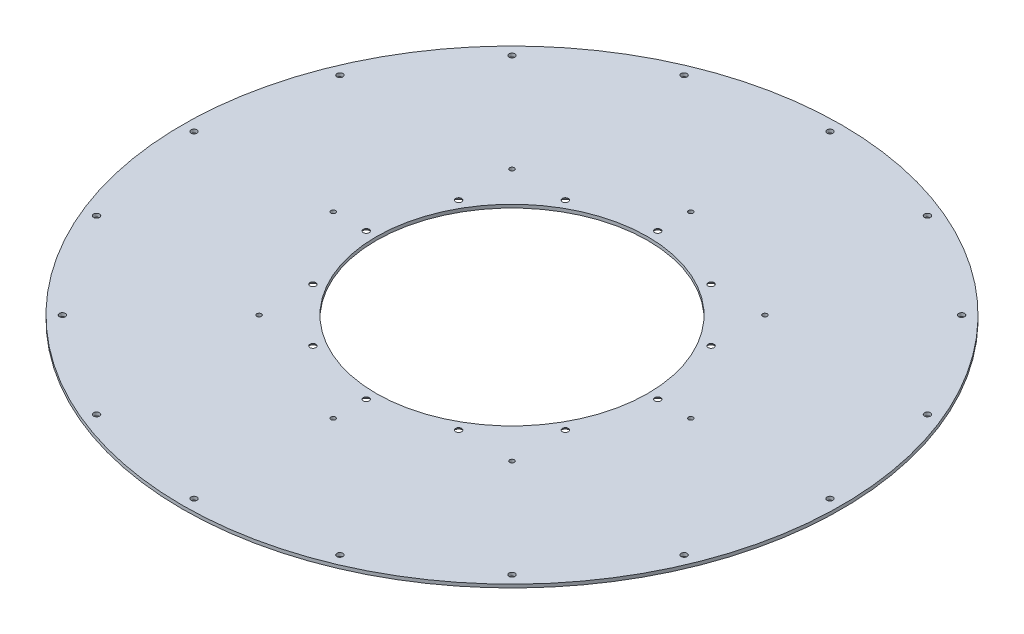
from build123d import *

# Parameters (mm, degrees)
SKETCH1_R                    = 497.5
SKETCH1_R_2                  = 205
BOSS_EXTRUDE1_DEPTH          = 5
SKETCH2_R                    = 4.5
SKETCH2_R_2                  = 3.5
CUT_EXTRUDE1_DEPTH           = 10
CIRPATTERN1_OUTLINE_R        = 4.5
CIRPATTERN1_DEPTH            = 5
CIRPATTERN2_COUNT            = 8
SKETCH3_R                    = 4.5
CUT_EXTRUDE3_DEPTH           = 10
CUT_EXTRUDE3_DRAFT           = 40
CIRPATTERN3_COPY_1_SKETCH_R  = 4.5
CIRPATTERN3_COPY_1_DEPTH     = 10
CIRPATTERN3_COPY_1_DRAFT     = 40
CIRPATTERN3_COPY_2_SKETCH_R  = 4.5
CIRPATTERN3_COPY_2_DEPTH     = 10
CIRPATTERN3_COPY_2_DRAFT     = 40
CIRPATTERN3_COPY_3_SKETCH_R  = 4.5
CIRPATTERN3_COPY_3_DEPTH     = 10
CIRPATTERN3_COPY_3_DRAFT     = 40
CIRPATTERN3_COPY_4_SKETCH_R  = 4.5
CIRPATTERN3_COPY_4_DEPTH     = 10
CIRPATTERN3_COPY_4_DRAFT     = 40
CIRPATTERN3_COPY_5_SKETCH_R  = 4.5
CIRPATTERN3_COPY_5_DEPTH     = 10
CIRPATTERN3_COPY_5_DRAFT     = 40
CIRPATTERN3_COPY_6_SKETCH_R  = 4.5
CIRPATTERN3_COPY_6_DEPTH     = 10
CIRPATTERN3_COPY_6_DRAFT     = 40
CIRPATTERN3_COPY_7_SKETCH_R  = 4.5
CIRPATTERN3_COPY_7_DEPTH     = 10
CIRPATTERN3_COPY_7_DRAFT     = 40
CIRPATTERN3_COPY_8_SKETCH_R  = 4.5
CIRPATTERN3_COPY_8_DEPTH     = 10
CIRPATTERN3_COPY_8_DRAFT     = 40
CIRPATTERN3_COPY_9_SKETCH_R  = 4.5
CIRPATTERN3_COPY_9_DEPTH     = 10
CIRPATTERN3_COPY_9_DRAFT     = 40
CIRPATTERN3_COPY_10_SKETCH_R = 4.5
CIRPATTERN3_COPY_10_DEPTH    = 10
CIRPATTERN3_COPY_10_DRAFT    = 40
CIRPATTERN3_COPY_11_SKETCH_R = 4.5
CIRPATTERN3_COPY_11_DEPTH    = 10
CIRPATTERN3_COPY_11_DRAFT    = 40


# Read off the part's stored shape, not the designer's step: CirPattern1
with BuildPart() as part:
    # Sketch1 → Boss-Extrude1 (new body)
    with BuildSketch(Plane(origin=(0, 0, 0), x_dir=(1, 0, 0), z_dir=(0, 1, 0))):
        with Locations(Location((0, 0, 0), (0, 0, 270))):
            Circle(SKETCH1_R)
        with Locations(Location((0, 0, 0), (0, 0, 270))):
            Circle(SKETCH1_R_2, mode=Mode.SUBTRACT)
    extrude(amount=BOSS_EXTRUDE1_DEPTH)

    # Sketch2 → Cut-Extrude1 (cut)
    with BuildSketch(Plane(origin=(0, 5, 0), x_dir=(1, 0, 0), z_dir=(0, 1, 0))):
        with Locations(Location((0, 480, 0), (0, 0, 270))):
            Circle(SKETCH2_R)
        with Locations(Location((0, 270, 0), (0, 0, 270))):
            Circle(SKETCH2_R_2)
    cut_extrude1 = extrude(amount=-CUT_EXTRUDE1_DEPTH, mode=Mode.SUBTRACT)

    # CirPattern1 outline → CirPattern1 (cut)
    with BuildSketch(Plane(origin=(0, 0, 0), x_dir=(1, 0, 0), z_dir=(0, 1, 0))):
        with Locations((183.688047535, 443.462175605)):
            Circle(CIRPATTERN1_OUTLINE_R)
        with Locations((339.41125497, 339.41125497)):
            Circle(CIRPATTERN1_OUTLINE_R)
        with Locations((443.462175605, 183.688047535)):
            Circle(CIRPATTERN1_OUTLINE_R)
        with Locations((480, 0)):
            Circle(CIRPATTERN1_OUTLINE_R)
        with Locations((443.462175605, -183.688047535)):
            Circle(CIRPATTERN1_OUTLINE_R)
        with Locations((339.41125497, -339.41125497)):
            Circle(CIRPATTERN1_OUTLINE_R)
        with Locations((183.688047535, -443.462175605)):
            Circle(CIRPATTERN1_OUTLINE_R)
        with Locations((0, -480)):
            Circle(CIRPATTERN1_OUTLINE_R)
        with Locations((-183.688047535, -443.462175605)):
            Circle(CIRPATTERN1_OUTLINE_R)
        with Locations((-339.41125497, -339.41125497)):
            Circle(CIRPATTERN1_OUTLINE_R)
        with Locations((-443.462175605, -183.688047535)):
            Circle(CIRPATTERN1_OUTLINE_R)
        with Locations((-480, 0)):
            Circle(CIRPATTERN1_OUTLINE_R)
        with Locations((-443.462175605, 183.688047535)):
            Circle(CIRPATTERN1_OUTLINE_R)
        with Locations((-339.41125497, 339.41125497)):
            Circle(CIRPATTERN1_OUTLINE_R)
        with Locations((-183.688047535, 443.462175605)):
            Circle(CIRPATTERN1_OUTLINE_R)
    extrude(amount=CIRPATTERN1_DEPTH, mode=Mode.SUBTRACT)

    # CirPattern2: Cut-Extrude1 ×8 about axis
    cirpattern2_axis = Axis((0, 0, 0), (0, 1, 0))
    for i in range(1, CIRPATTERN2_COUNT):
        add(cut_extrude1.rotate(cirpattern2_axis, i * 360 / CIRPATTERN2_COUNT), mode=Mode.SUBTRACT)


with BuildPart() as cut_extrude3_tool:
    # Sketch3 → Cut-Extrude3 (with draft: the straight prism first)
    with BuildSketch(Plane(origin=(0, 5, 0), x_dir=(1, 0, 0), z_dir=(0, 1, 0))):
        with Locations((0, 220)):
            Circle(SKETCH3_R)
    extrude(amount=-CUT_EXTRUDE3_DEPTH)
    # Cut-Extrude3: the draft: its side faces are tilted about the plane it starts from
    cut_extrude3_sides = [cut_extrude3_tool.faces().sort_by_distance(p)[0] for p in [
        (-4.5, 0, -220),
    ]]
    draft(cut_extrude3_sides, Plane(origin=(0, 5, 0), x_dir=(1, 0, 0), z_dir=(0, 1, 0)), CUT_EXTRUDE3_DRAFT)


with BuildPart() as part_1:
    add(part.part)

    # Cut-Extrude3: cut by cut_extrude3_tool
    add(cut_extrude3_tool.part, mode=Mode.SUBTRACT)


with BuildPart() as cirpattern3_copy_1_tool:
    # CirPattern3 copy 1 sketch → CirPattern3 copy 1 (with draft: the straight prism first)
    with BuildSketch(Plane(origin=(0, 5, 0), x_dir=(0.8660254037844387, 0, -0.49999999999999994), z_dir=(0, 1, 0))):
        with Locations((0, 220)):
            Circle(CIRPATTERN3_COPY_1_SKETCH_R)
    extrude(amount=-CIRPATTERN3_COPY_1_DEPTH)
    # CirPattern3 copy 1: the draft: its side faces are tilted about the plane it starts from
    cirpattern3_copy_1_sides = [cirpattern3_copy_1_tool.faces().sort_by_distance(p)[0] for p in [
        (-113.897114317, 0, -188.275588833),
    ]]
    draft(cirpattern3_copy_1_sides, Plane(origin=(0, 5, 0), x_dir=(0.8660254037844387, 0, -0.49999999999999994), z_dir=(0, 1, 0)), CIRPATTERN3_COPY_1_DRAFT)


with BuildPart() as part_2:
    add(part_1.part)

    # CirPattern3 copy 1: cut by cirpattern3_copy_1_tool
    add(cirpattern3_copy_1_tool.part, mode=Mode.SUBTRACT)


with BuildPart() as cirpattern3_copy_2_tool:
    # CirPattern3 copy 2 sketch → CirPattern3 copy 2 (with draft: the straight prism first)
    with BuildSketch(Plane(origin=(0, 5, 0), x_dir=(0.5000000000000001, 0, -0.8660254037844386), z_dir=(0, 1, 0))):
        with Locations((0, 220)):
            Circle(CIRPATTERN3_COPY_2_SKETCH_R)
    extrude(amount=-CIRPATTERN3_COPY_2_DEPTH)
    # CirPattern3 copy 2: the draft: its side faces are tilted about the plane it starts from
    cirpattern3_copy_2_sides = [cirpattern3_copy_2_tool.faces().sort_by_distance(p)[0] for p in [
        (-192.775588833, 0, -106.102885683),
    ]]
    draft(cirpattern3_copy_2_sides, Plane(origin=(0, 5, 0), x_dir=(0.5000000000000001, 0, -0.8660254037844386), z_dir=(0, 1, 0)), CIRPATTERN3_COPY_2_DRAFT)


with BuildPart() as part_3:
    add(part_2.part)

    # CirPattern3 copy 2: cut by cirpattern3_copy_2_tool
    add(cirpattern3_copy_2_tool.part, mode=Mode.SUBTRACT)


with BuildPart() as cirpattern3_copy_3_tool:
    # CirPattern3 copy 3 sketch → CirPattern3 copy 3 (with draft: the straight prism first)
    with BuildSketch(Plane(origin=(0, 5, 0), x_dir=(0, 0, -1), z_dir=(0, 1, 0))):
        with Locations((0, 220)):
            Circle(CIRPATTERN3_COPY_3_SKETCH_R)
    extrude(amount=-CIRPATTERN3_COPY_3_DEPTH)
    # CirPattern3 copy 3: the draft: its side faces are tilted about the plane it starts from
    cirpattern3_copy_3_sides = [cirpattern3_copy_3_tool.faces().sort_by_distance(p)[0] for p in [
        (-220, 0, 4.5),
    ]]
    draft(cirpattern3_copy_3_sides, Plane(origin=(0, 5, 0), x_dir=(0, 0, -1), z_dir=(0, 1, 0)), CIRPATTERN3_COPY_3_DRAFT)


with BuildPart() as part_4:
    add(part_3.part)

    # CirPattern3 copy 3: cut by cirpattern3_copy_3_tool
    add(cirpattern3_copy_3_tool.part, mode=Mode.SUBTRACT)


with BuildPart() as cirpattern3_copy_4_tool:
    # CirPattern3 copy 4 sketch → CirPattern3 copy 4 (with draft: the straight prism first)
    with BuildSketch(Plane(origin=(0, 5, 0), x_dir=(-0.4999999999999998, 0, -0.8660254037844387), z_dir=(0, 1, 0))):
        with Locations((0, 220)):
            Circle(CIRPATTERN3_COPY_4_SKETCH_R)
    extrude(amount=-CIRPATTERN3_COPY_4_DEPTH)
    # CirPattern3 copy 4: the draft: its side faces are tilted about the plane it starts from
    cirpattern3_copy_4_sides = [cirpattern3_copy_4_tool.faces().sort_by_distance(p)[0] for p in [
        (-188.275588833, 0, 113.897114317),
    ]]
    draft(cirpattern3_copy_4_sides, Plane(origin=(0, 5, 0), x_dir=(-0.4999999999999998, 0, -0.8660254037844387), z_dir=(0, 1, 0)), CIRPATTERN3_COPY_4_DRAFT)


with BuildPart() as part_5:
    add(part_4.part)

    # CirPattern3 copy 4: cut by cirpattern3_copy_4_tool
    add(cirpattern3_copy_4_tool.part, mode=Mode.SUBTRACT)


with BuildPart() as cirpattern3_copy_5_tool:
    # CirPattern3 copy 5 sketch → CirPattern3 copy 5 (with draft: the straight prism first)
    with BuildSketch(Plane(origin=(0, 5, 0), x_dir=(-0.8660254037844387, 0, -0.49999999999999994), z_dir=(0, 1, 0))):
        with Locations((0, 220)):
            Circle(CIRPATTERN3_COPY_5_SKETCH_R)
    extrude(amount=-CIRPATTERN3_COPY_5_DEPTH)
    # CirPattern3 copy 5: the draft: its side faces are tilted about the plane it starts from
    cirpattern3_copy_5_sides = [cirpattern3_copy_5_tool.faces().sort_by_distance(p)[0] for p in [
        (-106.102885683, 0, 192.775588833),
    ]]
    draft(cirpattern3_copy_5_sides, Plane(origin=(0, 5, 0), x_dir=(-0.8660254037844387, 0, -0.49999999999999994), z_dir=(0, 1, 0)), CIRPATTERN3_COPY_5_DRAFT)


with BuildPart() as part_6:
    add(part_5.part)

    # CirPattern3 copy 5: cut by cirpattern3_copy_5_tool
    add(cirpattern3_copy_5_tool.part, mode=Mode.SUBTRACT)


with BuildPart() as cirpattern3_copy_6_tool:
    # CirPattern3 copy 6 sketch → CirPattern3 copy 6 (with draft: the straight prism first)
    with BuildSketch(Plane(origin=(0, 5, 0), x_dir=(-1, 0, 0), z_dir=(0, 1, 0))):
        with Locations((0, 220)):
            Circle(CIRPATTERN3_COPY_6_SKETCH_R)
    extrude(amount=-CIRPATTERN3_COPY_6_DEPTH)
    # CirPattern3 copy 6: the draft: its side faces are tilted about the plane it starts from
    cirpattern3_copy_6_sides = [cirpattern3_copy_6_tool.faces().sort_by_distance(p)[0] for p in [
        (4.5, 0, 220),
    ]]
    draft(cirpattern3_copy_6_sides, Plane(origin=(0, 5, 0), x_dir=(-1, 0, 0), z_dir=(0, 1, 0)), CIRPATTERN3_COPY_6_DRAFT)


with BuildPart() as part_7:
    add(part_6.part)

    # CirPattern3 copy 6: cut by cirpattern3_copy_6_tool
    add(cirpattern3_copy_6_tool.part, mode=Mode.SUBTRACT)


with BuildPart() as cirpattern3_copy_7_tool:
    # CirPattern3 copy 7 sketch → CirPattern3 copy 7 (with draft: the straight prism first)
    with BuildSketch(Plane(origin=(0, 5, 0), x_dir=(-0.8660254037844386, 0, 0.5000000000000001), z_dir=(0, 1, 0))):
        with Locations((0, 220)):
            Circle(CIRPATTERN3_COPY_7_SKETCH_R)
    extrude(amount=-CIRPATTERN3_COPY_7_DEPTH)
    # CirPattern3 copy 7: the draft: its side faces are tilted about the plane it starts from
    cirpattern3_copy_7_sides = [cirpattern3_copy_7_tool.faces().sort_by_distance(p)[0] for p in [
        (113.897114317, 0, 188.275588833),
    ]]
    draft(cirpattern3_copy_7_sides, Plane(origin=(0, 5, 0), x_dir=(-0.8660254037844386, 0, 0.5000000000000001), z_dir=(0, 1, 0)), CIRPATTERN3_COPY_7_DRAFT)


with BuildPart() as part_8:
    add(part_7.part)

    # CirPattern3 copy 7: cut by cirpattern3_copy_7_tool
    add(cirpattern3_copy_7_tool.part, mode=Mode.SUBTRACT)


with BuildPart() as cirpattern3_copy_8_tool:
    # CirPattern3 copy 8 sketch → CirPattern3 copy 8 (with draft: the straight prism first)
    with BuildSketch(Plane(origin=(0, 5, 0), x_dir=(-0.5000000000000004, 0, 0.8660254037844384), z_dir=(0, 1, 0))):
        with Locations((0, 220)):
            Circle(CIRPATTERN3_COPY_8_SKETCH_R)
    extrude(amount=-CIRPATTERN3_COPY_8_DEPTH)
    # CirPattern3 copy 8: the draft: its side faces are tilted about the plane it starts from
    cirpattern3_copy_8_sides = [cirpattern3_copy_8_tool.faces().sort_by_distance(p)[0] for p in [
        (192.775588833, 0, 106.102885683),
    ]]
    draft(cirpattern3_copy_8_sides, Plane(origin=(0, 5, 0), x_dir=(-0.5000000000000004, 0, 0.8660254037844384), z_dir=(0, 1, 0)), CIRPATTERN3_COPY_8_DRAFT)


with BuildPart() as part_9:
    add(part_8.part)

    # CirPattern3 copy 8: cut by cirpattern3_copy_8_tool
    add(cirpattern3_copy_8_tool.part, mode=Mode.SUBTRACT)


with BuildPart() as cirpattern3_copy_9_tool:
    # CirPattern3 copy 9 sketch → CirPattern3 copy 9 (with draft: the straight prism first)
    with BuildSketch(Plane.ZX.offset(5)):
        with Locations((0, 220)):
            Circle(CIRPATTERN3_COPY_9_SKETCH_R)
    extrude(amount=-CIRPATTERN3_COPY_9_DEPTH)
    # CirPattern3 copy 9: the draft: its side faces are tilted about the plane it starts from
    cirpattern3_copy_9_sides = [cirpattern3_copy_9_tool.faces().sort_by_distance(p)[0] for p in [
        (220, 0, -4.5),
    ]]
    draft(cirpattern3_copy_9_sides, Plane.ZX.offset(5), CIRPATTERN3_COPY_9_DRAFT)


with BuildPart() as part_10:
    add(part_9.part)

    # CirPattern3 copy 9: cut by cirpattern3_copy_9_tool
    add(cirpattern3_copy_9_tool.part, mode=Mode.SUBTRACT)


with BuildPart() as cirpattern3_copy_10_tool:
    # CirPattern3 copy 10 sketch → CirPattern3 copy 10 (with draft: the straight prism first)
    with BuildSketch(Plane(origin=(0, 5, 0), x_dir=(0.5000000000000001, 0, 0.8660254037844386), z_dir=(0, 1, 0))):
        with Locations((0, 220)):
            Circle(CIRPATTERN3_COPY_10_SKETCH_R)
    extrude(amount=-CIRPATTERN3_COPY_10_DEPTH)
    # CirPattern3 copy 10: the draft: its side faces are tilted about the plane it starts from
    cirpattern3_copy_10_sides = [cirpattern3_copy_10_tool.faces().sort_by_distance(p)[0] for p in [
        (188.275588833, 0, -113.897114317),
    ]]
    draft(cirpattern3_copy_10_sides, Plane(origin=(0, 5, 0), x_dir=(0.5000000000000001, 0, 0.8660254037844386), z_dir=(0, 1, 0)), CIRPATTERN3_COPY_10_DRAFT)


with BuildPart() as part_11:
    add(part_10.part)

    # CirPattern3 copy 10: cut by cirpattern3_copy_10_tool
    add(cirpattern3_copy_10_tool.part, mode=Mode.SUBTRACT)


with BuildPart() as cirpattern3_copy_11_tool:
    # CirPattern3 copy 11 sketch → CirPattern3 copy 11 (with draft: the straight prism first)
    with BuildSketch(Plane(origin=(0, 5, 0), x_dir=(0.8660254037844384, 0, 0.5000000000000004), z_dir=(0, 1, 0))):
        with Locations((0, 220)):
            Circle(CIRPATTERN3_COPY_11_SKETCH_R)
    extrude(amount=-CIRPATTERN3_COPY_11_DEPTH)
    # CirPattern3 copy 11: the draft: its side faces are tilted about the plane it starts from
    cirpattern3_copy_11_sides = [cirpattern3_copy_11_tool.faces().sort_by_distance(p)[0] for p in [
        (106.102885683, 0, -192.775588833),
    ]]
    draft(cirpattern3_copy_11_sides, Plane(origin=(0, 5, 0), x_dir=(0.8660254037844384, 0, 0.5000000000000004), z_dir=(0, 1, 0)), CIRPATTERN3_COPY_11_DRAFT)


with BuildPart() as part_12:
    add(part_11.part)

    # CirPattern3 copy 11: cut by cirpattern3_copy_11_tool
    add(cirpattern3_copy_11_tool.part, mode=Mode.SUBTRACT)


solid = part_12.part
